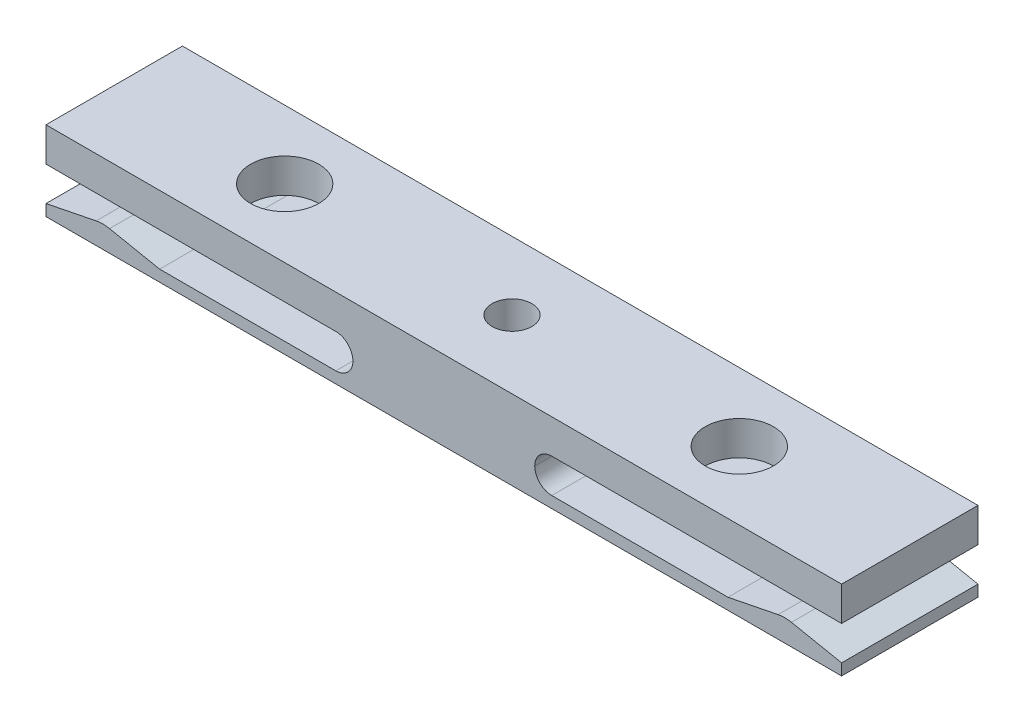
from build123d import *

# Parameters (mm, degrees)
BOSS_EXTRUDE1_DEPTH = 6
SKETCH5_R           = 4
BOSS_EXTRUDE2_DEPTH = 1
BOSS_EXTRUDE3_DEPTH = 6
SKETCH6_R           = 2
CUT_EXTRUDE2_DEPTH  = 37.400549446
FILLET2_R           = 3
FILLET3_R           = 1.5
SKETCH3_R           = 1.75
CUT_EXTRUDE1_DEPTH  = 37.193922142
CUT_EXTRUDE3_REACH  = 38.401
SKETCH8_R           = 3
CHAMFER1_SIZE       = 1


with BuildPart() as part:
    # Sketch1 → Boss-Extrude1 (new, symmetric)
    with BuildSketch(Plane.XY):
        Polygon((-35, 0), (-35, 1), (-30, 2), (-25, 1), (0, 1), (0, 0), align=None)
    extrude(amount=BOSS_EXTRUDE1_DEPTH, both=True)

    # Sketch5 → Boss-Extrude2 (add)
    with BuildSketch(Plane.XZ):
        with Locations(Location((-20, 0, 0), (0, 0, 180))):
            Circle(SKETCH5_R)
    extrude(amount=BOSS_EXTRUDE2_DEPTH)

    # Sketch7 → Boss-Extrude3 (add, symmetric)
    with BuildSketch(Plane.XY):
        Polygon((0, 1), (0, 7), (-35, 7), (-35, 4), (-8, 4), (-8, 1), align=None)
    extrude(amount=BOSS_EXTRUDE3_DEPTH, both=True)

    # Sketch6 → Cut-Extrude2 (cut, through all)
    with BuildSketch(Plane.XZ.offset(1)):
        with Locations((-20, 0)):
            Circle(SKETCH6_R)
    extrude(amount=-CUT_EXTRUDE2_DEPTH, mode=Mode.SUBTRACT)

    # Fillet2
    fillet2_edges = [part.edges().sort_by_distance(p)[0] for p in [
        (-30, 2, 0),
    ]]
    fillet(fillet2_edges, radius=FILLET2_R)

    # Fillet3
    fillet3_edges = [part.edges().sort_by_distance(p)[0] for p in [
        (-8, 4, 0),
        (-8, 1, 0),
    ]]
    fillet(fillet3_edges, radius=FILLET3_R - 0.0001)  # a hair under: the kernel refuses the full size

    # Mirror1: part across plane


with BuildPart() as part_1:
    add(part.part)
    add(part.part.mirror(Plane(origin=(0, 0, 0), x_dir=(0, 0, 1), z_dir=(1, 0, 0))))

    # Sketch3 → Cut-Extrude1 (cut, through all)
    with BuildSketch(Plane(origin=(0, 0, 0), x_dir=(1, 0, 0), z_dir=(0, 1, 0))):
        with Locations(Location((0, 0, 0), (0, 0, 270))):
            Circle(SKETCH3_R)
    extrude(amount=CUT_EXTRUDE1_DEPTH, mode=Mode.SUBTRACT)

    # Sketch8 → Cut-Extrude3 (cut, up to next)
    with BuildSketch(Plane(origin=(0, 7, 0), x_dir=(1, 0, 0), z_dir=(0, 1, 0)), mode=Mode.PRIVATE) as cut_extrude3_sk1:
        with Locations(Location((20, 0, 0), (0, 0, 180))):
            Circle(SKETCH8_R)
    cut_extrude3_tool1 = extrude(cut_extrude3_sk1.sketch, amount=-CUT_EXTRUDE3_REACH, mode=Mode.PRIVATE) & part_1.part
    # Sketch8 → Cut-Extrude3 (cut, up to next)
    with BuildSketch(Plane(origin=(0, 7, 0), x_dir=(1, 0, 0), z_dir=(0, 1, 0)), mode=Mode.PRIVATE) as cut_extrude3_sk2:
        with Locations(Location((-20, 0, 0), (0, 0, 180))):
            Circle(SKETCH8_R)
    cut_extrude3_tool2 = extrude(cut_extrude3_sk2.sketch, amount=-CUT_EXTRUDE3_REACH, mode=Mode.PRIVATE) & part_1.part
    add(cut_extrude3_tool1.solids().sort_by_distance((20, 7, 0))[0], mode=Mode.SUBTRACT)
    add(cut_extrude3_tool2.solids().sort_by_distance((-20, 7, 0))[0], mode=Mode.SUBTRACT)

    # Chamfer1
    chamfer1_edges = [part_1.edges().sort_by_distance(p)[0] for p in [
        (-16, -1, 0),
        (16, -1, 0),
    ]]
    chamfer(chamfer1_edges, length=CHAMFER1_SIZE - 0.0001)  # a hair under: the kernel refuses the full size


solid = part_1.part
